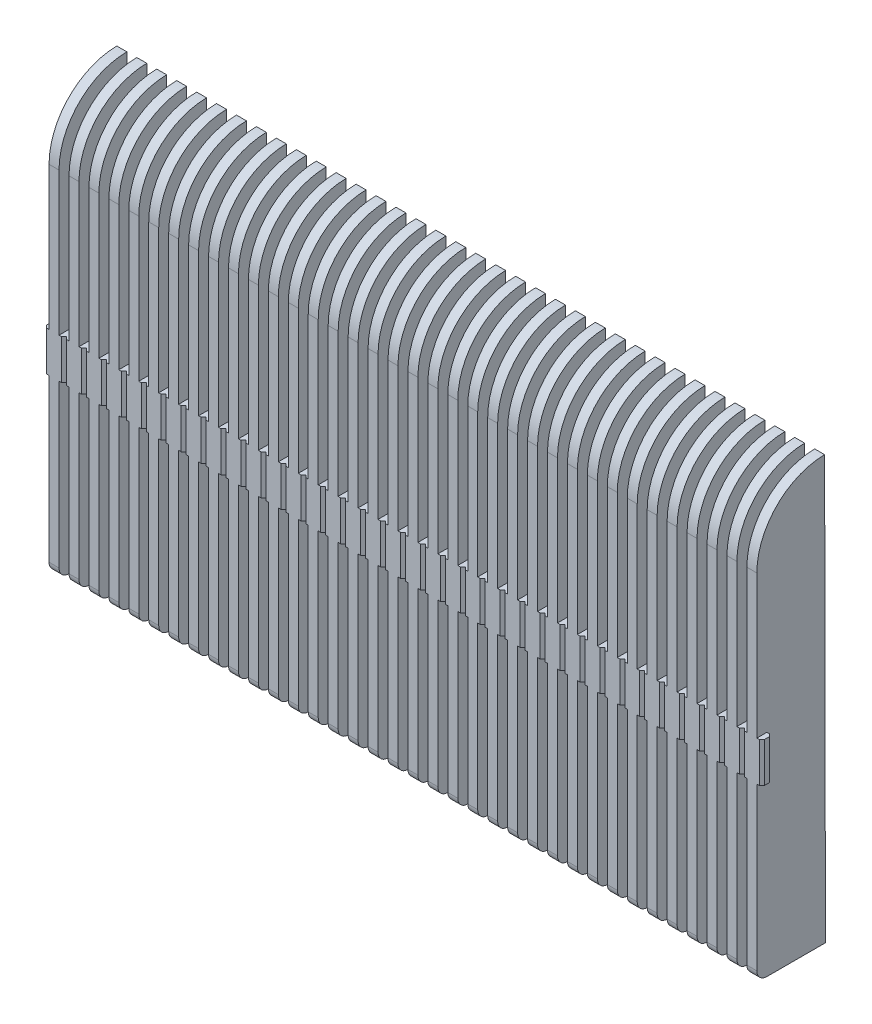
from build123d import *

# Parameters (mm, degrees)
SKETCH1_W                = 10.922
SKETCH1_H                = 12.7
SKETCH1_W_2              = 12.7
SKETCH1_H_2              = 10.922
BOSS_EXTRUDE1_DEPTH      = 2.38125
SKETCH2_W                = 12.7
SKETCH2_H                = 12.7
BOSS_EXTRUDE2_DEPTH      = 67.3862
SKETCH3_W                = 34.29
SKETCH3_H                = 34.29
BOSS_EXTRUDE3_DEPTH      = 2.38125
FILLET15_R               = 10.922
SKETCH4_R                = 5.55625
CUT_EXTRUDE1_DEPTH       = 66.675
CUT_EXTRUDE2_REACH       = 78.171
SKETCH5_W                = 10.922
SKETCH5_H                = 3.175
SKETCH5_W_2              = 3.175
SKETCH5_H_2              = 10.922
FILLET18_R               = 3.175
FILLET28_R               = 0.79375
FILLET29_R               = 1.5875
BOSS_EXTRUDE4_DEPTH      = 112.7125
CUT_EXTRUDE4_DEPTH       = 57.15
SKETCH7_W                = 1.5875
SKETCH7_H                = 67.3862
CUT_EXTRUDE5_DEPTH       = 114.3
LPATTERN1_COUNT          = 35
LPATTERN1_PITCH          = 3.175
BOSS_EXTRUDE5_DEPTH      = 0.79375
BOSS_EXTRUDE5_DEPTH_BACK = 113.50625
SKETCH8_W                = 1.5875
SKETCH8_H                = 6.35
CUT_EXTRUDE6_DEPTH       = 137.026821246
LPATTERN2_COUNT          = 36
LPATTERN2_PITCH          = 3.175
LPATTERN2_COL_COUNT      = 2
LPATTERN2_COL_PITCH      = 3.175


# Some blends are built 0.0001 mm under size
with BuildPart() as part:
    # Sketch1 → Boss-Extrude1 (new body)
    with BuildSketch(Plane(origin=(0, 0, 0), x_dir=(1, 0, 0), z_dir=(0, 1, 0))):
        with Locations((-11.811, 0)):
            Rectangle(SKETCH1_W, SKETCH1_H)
        Rectangle(SKETCH1_W_2, SKETCH1_H)
        with Locations((0, 11.811)):
            Rectangle(SKETCH1_W_2, SKETCH1_H_2)
        with Locations((11.811, 0)):
            Rectangle(SKETCH1_W, SKETCH1_H)
        with Locations((0, -11.811)):
            Rectangle(SKETCH1_W_2, SKETCH1_H_2)
    extrude(amount=BOSS_EXTRUDE1_DEPTH)

    # Sketch2 → Boss-Extrude2 (add)
    with BuildSketch(Plane(origin=(0, 2.38125, 0), x_dir=(1, 0, 0), z_dir=(0, 1, 0))):
        Rectangle(SKETCH2_W, SKETCH2_H)
    extrude(amount=BOSS_EXTRUDE2_DEPTH)

    # Sketch3 → Boss-Extrude3 (add)
    with BuildSketch(Plane(origin=(0, 69.76745, 0), x_dir=(1, 0, 0), z_dir=(0, 1, 0))):
        Rectangle(SKETCH3_W, SKETCH3_H)
    extrude(amount=BOSS_EXTRUDE3_DEPTH)

    # Fillet15
    # the kernel refuses this fillet: 10.922 mm, written as the material it adds along each edge
    with BuildSketch(Plane(origin=(6.35, 69.76745, 6.35), x_dir=(1, 0, 0), z_dir=(0, 0, -1))) as fillet15_piece_1_section:
        with BuildLine():
            CenterArc((FILLET15_R, FILLET15_R), FILLET15_R, 180, 90)
            Line((0, FILLET15_R), (0, 0))
            Line((0, 0), (FILLET15_R, 0))
        make_face()
    fillet15_piece_1 = extrude(amount=12.7, mode=Mode.PRIVATE)
    fillet15_piece_1 = split(fillet15_piece_1, bisect_by=Plane(origin=(17.145, 67.292403203, 0), z_dir=(-1, 0, 0)), keep=Keep.TOP, mode=Mode.PRIVATE)
    add(fillet15_piece_1)
    with BuildSketch(Plane(origin=(6.35, 69.76745, -6.35), x_dir=(0, 0, -1), z_dir=(-1, 0, 0))) as fillet15_piece_2_section:
        with BuildLine():
            CenterArc((FILLET15_R, FILLET15_R), FILLET15_R, 180, 90)
            Line((0, FILLET15_R), (0, 0))
            Line((0, 0), (FILLET15_R, 0))
        make_face()
    fillet15_piece_2 = extrude(amount=12.7, mode=Mode.PRIVATE)
    fillet15_piece_2 = split(fillet15_piece_2, bisect_by=Plane(origin=(0, 67.292403203, -17.145), z_dir=(0, 0, 1)), keep=Keep.TOP, mode=Mode.PRIVATE)
    add(fillet15_piece_2)
    with BuildSketch(Plane(origin=(-6.35, 69.76745, -6.35), x_dir=(-1, 0, 0), z_dir=(0, 0, 1))) as fillet15_piece_3_section:
        with BuildLine():
            CenterArc((FILLET15_R, FILLET15_R), FILLET15_R, 180, 90)
            Line((0, FILLET15_R), (0, 0))
            Line((0, 0), (FILLET15_R, 0))
        make_face()
    fillet15_piece_3 = extrude(amount=12.7, mode=Mode.PRIVATE)
    fillet15_piece_3 = split(fillet15_piece_3, bisect_by=Plane(origin=(-17.145, 67.292403203, 0), z_dir=(1, 0, 0)), keep=Keep.TOP, mode=Mode.PRIVATE)
    add(fillet15_piece_3)
    with BuildSketch(Plane(origin=(-6.35, 69.76745, 6.35), x_dir=(0, 0, 1), z_dir=(1, 0, 0))) as fillet15_piece_4_section:
        with BuildLine():
            CenterArc((FILLET15_R, FILLET15_R), FILLET15_R, 180, 90)
            Line((0, FILLET15_R), (0, 0))
            Line((0, 0), (FILLET15_R, 0))
        make_face()
    fillet15_piece_4 = extrude(amount=12.7, mode=Mode.PRIVATE)
    fillet15_piece_4 = split(fillet15_piece_4, bisect_by=Plane(origin=(0, 67.292403203, 17.145), z_dir=(0, 0, -1)), keep=Keep.TOP, mode=Mode.PRIVATE)
    add(fillet15_piece_4)
    with BuildSketch(Plane(origin=(-6.35, 69.76745, 6.35), x_dir=(0, 0, 1), z_dir=(1, 0, 0))) as fillet15_piece_5a_section:
        with BuildLine():
            CenterArc((FILLET15_R, FILLET15_R), FILLET15_R, 180, 90)
            Line((0, FILLET15_R), (0, 0))
            Line((0, 0), (FILLET15_R, 0))
        make_face()
    fillet15_piece_5a = extrude(amount=40.005, mode=Mode.PRIVATE)
    fillet15_piece_5a = split(fillet15_piece_5a, bisect_by=Plane(origin=(11.7475, 67.292403203, 17.145), z_dir=(0, 0, -1)), keep=Keep.TOP, mode=Mode.PRIVATE)
    fillet15_piece_5a = split(fillet15_piece_5a, bisect_by=Plane(origin=(17.145, 67.292403203, 8.815024112), z_dir=(-1, 0, 0)), keep=Keep.TOP, mode=Mode.PRIVATE)
    fillet15_piece_5a = split(fillet15_piece_5a, bisect_by=Plane(origin=(6.35, 67.292403203, 8.815024112), z_dir=(1, 0, 0)), keep=Keep.TOP, mode=Mode.PRIVATE)
    with BuildSketch(Plane(origin=(6.35, 69.76745, 33.655), x_dir=(1, 0, 0), z_dir=(0, 0, -1))) as fillet15_piece_5b_section:
        with BuildLine():
            CenterArc((FILLET15_R, FILLET15_R), FILLET15_R, 180, 90)
            Line((0, FILLET15_R), (0, 0))
            Line((0, 0), (FILLET15_R, 0))
        make_face()
    fillet15_piece_5b = extrude(amount=40.005, mode=Mode.PRIVATE)
    fillet15_piece_5b = split(fillet15_piece_5b, bisect_by=Plane(origin=(8.815024112, 67.292403203, 17.145), z_dir=(0, 0, -1)), keep=Keep.TOP, mode=Mode.PRIVATE)
    fillet15_piece_5b = split(fillet15_piece_5b, bisect_by=Plane(origin=(17.145, 67.292403203, 11.7475), z_dir=(-1, 0, 0)), keep=Keep.TOP, mode=Mode.PRIVATE)
    fillet15_piece_5b = split(fillet15_piece_5b, bisect_by=Plane(origin=(8.815024112, 67.292403203, 6.35), z_dir=(0, 0, 1)), keep=Keep.TOP, mode=Mode.PRIVATE)
    fillet15_piece_5 = fillet15_piece_5a & fillet15_piece_5b
    add(fillet15_piece_5)
    with BuildSketch(Plane(origin=(6.35, 69.76745, 6.35), x_dir=(1, 0, 0), z_dir=(0, 0, -1))) as fillet15_piece_6a_section:
        with BuildLine():
            CenterArc((FILLET15_R, FILLET15_R), FILLET15_R, 180, 90)
            Line((0, FILLET15_R), (0, 0))
            Line((0, 0), (FILLET15_R, 0))
        make_face()
    fillet15_piece_6a = extrude(amount=40.005, mode=Mode.PRIVATE)
    fillet15_piece_6a = split(fillet15_piece_6a, bisect_by=Plane(origin=(17.145, 67.292403203, -11.7475), z_dir=(-1, 0, 0)), keep=Keep.TOP, mode=Mode.PRIVATE)
    fillet15_piece_6a = split(fillet15_piece_6a, bisect_by=Plane(origin=(8.815024112, 67.292403203, -17.145), z_dir=(0, 0, 1)), keep=Keep.TOP, mode=Mode.PRIVATE)
    fillet15_piece_6a = split(fillet15_piece_6a, bisect_by=Plane(origin=(8.815024112, 67.292403203, -6.35), z_dir=(0, 0, -1)), keep=Keep.TOP, mode=Mode.PRIVATE)
    with BuildSketch(Plane(origin=(33.655, 69.76745, -6.35), x_dir=(0, 0, -1), z_dir=(-1, 0, 0))) as fillet15_piece_6b_section:
        with BuildLine():
            CenterArc((FILLET15_R, FILLET15_R), FILLET15_R, 180, 90)
            Line((0, FILLET15_R), (0, 0))
            Line((0, 0), (FILLET15_R, 0))
        make_face()
    fillet15_piece_6b = extrude(amount=40.005, mode=Mode.PRIVATE)
    fillet15_piece_6b = split(fillet15_piece_6b, bisect_by=Plane(origin=(17.145, 67.292403203, -8.815024112), z_dir=(-1, 0, 0)), keep=Keep.TOP, mode=Mode.PRIVATE)
    fillet15_piece_6b = split(fillet15_piece_6b, bisect_by=Plane(origin=(11.7475, 67.292403203, -17.145), z_dir=(0, 0, 1)), keep=Keep.TOP, mode=Mode.PRIVATE)
    fillet15_piece_6b = split(fillet15_piece_6b, bisect_by=Plane(origin=(6.35, 67.292403203, -8.815024112), z_dir=(1, 0, 0)), keep=Keep.TOP, mode=Mode.PRIVATE)
    fillet15_piece_6 = fillet15_piece_6a & fillet15_piece_6b
    add(fillet15_piece_6)
    with BuildSketch(Plane(origin=(-6.35, 69.76745, -33.655), x_dir=(-1, 0, 0), z_dir=(0, 0, 1))) as fillet15_piece_7a_section:
        with BuildLine():
            CenterArc((FILLET15_R, FILLET15_R), FILLET15_R, 180, 90)
            Line((0, FILLET15_R), (0, 0))
            Line((0, 0), (FILLET15_R, 0))
        make_face()
    fillet15_piece_7a = extrude(amount=40.005, mode=Mode.PRIVATE)
    fillet15_piece_7a = split(fillet15_piece_7a, bisect_by=Plane(origin=(-17.145, 67.292403203, -11.7475), z_dir=(1, 0, 0)), keep=Keep.TOP, mode=Mode.PRIVATE)
    fillet15_piece_7a = split(fillet15_piece_7a, bisect_by=Plane(origin=(-8.815024112, 67.292403203, -17.145), z_dir=(0, 0, 1)), keep=Keep.TOP, mode=Mode.PRIVATE)
    fillet15_piece_7a = split(fillet15_piece_7a, bisect_by=Plane(origin=(-8.815024112, 67.292403203, -6.35), z_dir=(0, 0, -1)), keep=Keep.TOP, mode=Mode.PRIVATE)
    with BuildSketch(Plane(origin=(6.35, 69.76745, -6.35), x_dir=(0, 0, -1), z_dir=(-1, 0, 0))) as fillet15_piece_7b_section:
        with BuildLine():
            CenterArc((FILLET15_R, FILLET15_R), FILLET15_R, 180, 90)
            Line((0, FILLET15_R), (0, 0))
            Line((0, 0), (FILLET15_R, 0))
        make_face()
    fillet15_piece_7b = extrude(amount=40.005, mode=Mode.PRIVATE)
    fillet15_piece_7b = split(fillet15_piece_7b, bisect_by=Plane(origin=(-17.145, 67.292403203, -8.815024112), z_dir=(1, 0, 0)), keep=Keep.TOP, mode=Mode.PRIVATE)
    fillet15_piece_7b = split(fillet15_piece_7b, bisect_by=Plane(origin=(-11.7475, 67.292403203, -17.145), z_dir=(0, 0, 1)), keep=Keep.TOP, mode=Mode.PRIVATE)
    fillet15_piece_7b = split(fillet15_piece_7b, bisect_by=Plane(origin=(-6.35, 67.292403203, -8.815024112), z_dir=(-1, 0, 0)), keep=Keep.TOP, mode=Mode.PRIVATE)
    fillet15_piece_7 = fillet15_piece_7a & fillet15_piece_7b
    add(fillet15_piece_7)
    with BuildSketch(Plane(origin=(-6.35, 69.76745, -6.35), x_dir=(-1, 0, 0), z_dir=(0, 0, 1))) as fillet15_piece_8a_section:
        with BuildLine():
            CenterArc((FILLET15_R, FILLET15_R), FILLET15_R, 180, 90)
            Line((0, FILLET15_R), (0, 0))
            Line((0, 0), (FILLET15_R, 0))
        make_face()
    fillet15_piece_8a = extrude(amount=40.005, mode=Mode.PRIVATE)
    fillet15_piece_8a = split(fillet15_piece_8a, bisect_by=Plane(origin=(-8.815024112, 67.292403203, 17.145), z_dir=(0, 0, -1)), keep=Keep.TOP, mode=Mode.PRIVATE)
    fillet15_piece_8a = split(fillet15_piece_8a, bisect_by=Plane(origin=(-17.145, 67.292403203, 11.7475), z_dir=(1, 0, 0)), keep=Keep.TOP, mode=Mode.PRIVATE)
    fillet15_piece_8a = split(fillet15_piece_8a, bisect_by=Plane(origin=(-8.815024112, 67.292403203, 6.35), z_dir=(0, 0, 1)), keep=Keep.TOP, mode=Mode.PRIVATE)
    with BuildSketch(Plane(origin=(-33.655, 69.76745, 6.35), x_dir=(0, 0, 1), z_dir=(1, 0, 0))) as fillet15_piece_8b_section:
        with BuildLine():
            CenterArc((FILLET15_R, FILLET15_R), FILLET15_R, 180, 90)
            Line((0, FILLET15_R), (0, 0))
            Line((0, 0), (FILLET15_R, 0))
        make_face()
    fillet15_piece_8b = extrude(amount=40.005, mode=Mode.PRIVATE)
    fillet15_piece_8b = split(fillet15_piece_8b, bisect_by=Plane(origin=(-11.7475, 67.292403203, 17.145), z_dir=(0, 0, -1)), keep=Keep.TOP, mode=Mode.PRIVATE)
    fillet15_piece_8b = split(fillet15_piece_8b, bisect_by=Plane(origin=(-17.145, 67.292403203, 8.815024112), z_dir=(1, 0, 0)), keep=Keep.TOP, mode=Mode.PRIVATE)
    fillet15_piece_8b = split(fillet15_piece_8b, bisect_by=Plane(origin=(-6.35, 67.292403203, 8.815024112), z_dir=(-1, 0, 0)), keep=Keep.TOP, mode=Mode.PRIVATE)
    fillet15_piece_8 = fillet15_piece_8a & fillet15_piece_8b
    add(fillet15_piece_8)

    # Sketch4 → Cut-Extrude1 (cut)
    with BuildSketch(Plane.XZ):
        with Locations(Location((0, 0, 0), (0, 0, 270))):
            Circle(SKETCH4_R)
    extrude(amount=-CUT_EXTRUDE1_DEPTH, mode=Mode.SUBTRACT)

    # Sketch5 → Cut-Extrude2 (cut, up to next)
    with BuildSketch(Plane.XZ, mode=Mode.PRIVATE) as cut_extrude2_sk1:
        with Locations((-11.811, 4.7625)):
            Rectangle(SKETCH5_W, SKETCH5_H)
    cut_extrude2_tool1 = extrude(cut_extrude2_sk1.sketch, amount=-CUT_EXTRUDE2_REACH, mode=Mode.PRIVATE) & part.part
    # Sketch5 → Cut-Extrude2 (cut, up to next)
    with BuildSketch(Plane.XZ, mode=Mode.PRIVATE) as cut_extrude2_sk2:
        with Locations((-4.7625, 11.811)):
            Rectangle(SKETCH5_W_2, SKETCH5_H_2)
    cut_extrude2_tool2 = extrude(cut_extrude2_sk2.sketch, amount=-CUT_EXTRUDE2_REACH, mode=Mode.PRIVATE) & part.part
    # Sketch5 → Cut-Extrude2 (cut, up to next)
    with BuildSketch(Plane.XZ, mode=Mode.PRIVATE) as cut_extrude2_sk3:
        with Locations((4.7625, 11.811)):
            Rectangle(SKETCH5_W_2, SKETCH5_H_2)
    cut_extrude2_tool3 = extrude(cut_extrude2_sk3.sketch, amount=-CUT_EXTRUDE2_REACH, mode=Mode.PRIVATE) & part.part
    # Sketch5 → Cut-Extrude2 (cut, up to next)
    with BuildSketch(Plane.XZ, mode=Mode.PRIVATE) as cut_extrude2_sk4:
        with Locations((11.811, 4.7625)):
            Rectangle(SKETCH5_W, SKETCH5_H)
    cut_extrude2_tool4 = extrude(cut_extrude2_sk4.sketch, amount=-CUT_EXTRUDE2_REACH, mode=Mode.PRIVATE) & part.part
    # Sketch5 → Cut-Extrude2 (cut, up to next)
    with BuildSketch(Plane.XZ, mode=Mode.PRIVATE) as cut_extrude2_sk5:
        with Locations((11.811, -4.7625)):
            Rectangle(SKETCH5_W, SKETCH5_H)
    cut_extrude2_tool5 = extrude(cut_extrude2_sk5.sketch, amount=-CUT_EXTRUDE2_REACH, mode=Mode.PRIVATE) & part.part
    # Sketch5 → Cut-Extrude2 (cut, up to next)
    with BuildSketch(Plane.XZ, mode=Mode.PRIVATE) as cut_extrude2_sk6:
        with Locations((4.7625, -11.811)):
            Rectangle(SKETCH5_W_2, SKETCH5_H_2)
    cut_extrude2_tool6 = extrude(cut_extrude2_sk6.sketch, amount=-CUT_EXTRUDE2_REACH, mode=Mode.PRIVATE) & part.part
    # Sketch5 → Cut-Extrude2 (cut, up to next)
    with BuildSketch(Plane.XZ, mode=Mode.PRIVATE) as cut_extrude2_sk7:
        with Locations((-4.7625, -11.811)):
            Rectangle(SKETCH5_W_2, SKETCH5_H_2)
    cut_extrude2_tool7 = extrude(cut_extrude2_sk7.sketch, amount=-CUT_EXTRUDE2_REACH, mode=Mode.PRIVATE) & part.part
    # Sketch5 → Cut-Extrude2 (cut, up to next)
    with BuildSketch(Plane.XZ, mode=Mode.PRIVATE) as cut_extrude2_sk8:
        with Locations((-11.811, -4.7625)):
            Rectangle(SKETCH5_W, SKETCH5_H)
    cut_extrude2_tool8 = extrude(cut_extrude2_sk8.sketch, amount=-CUT_EXTRUDE2_REACH, mode=Mode.PRIVATE) & part.part
    add(cut_extrude2_tool1.solids().sort_by_distance((-11.811, 0, 4.7625))[0], mode=Mode.SUBTRACT)
    add(cut_extrude2_tool2.solids().sort_by_distance((-4.7625, 0, 11.811))[0], mode=Mode.SUBTRACT)
    add(cut_extrude2_tool3.solids().sort_by_distance((4.7625, 0, 11.811))[0], mode=Mode.SUBTRACT)
    add(cut_extrude2_tool4.solids().sort_by_distance((11.811, 0, 4.7625))[0], mode=Mode.SUBTRACT)
    add(cut_extrude2_tool5.solids().sort_by_distance((11.811, 0, -4.7625))[0], mode=Mode.SUBTRACT)
    add(cut_extrude2_tool6.solids().sort_by_distance((4.7625, 0, -11.811))[0], mode=Mode.SUBTRACT)
    add(cut_extrude2_tool7.solids().sort_by_distance((-4.7625, 0, -11.811))[0], mode=Mode.SUBTRACT)
    add(cut_extrude2_tool8.solids().sort_by_distance((-11.811, 0, -4.7625))[0], mode=Mode.SUBTRACT)

    # Fillet18
    fillet18_edges = [part.edges().sort_by_distance(p)[0] for p in [
        (-17.272, 1.190625, 3.175),
        (-17.272, 1.190625, -3.175),
        (-3.175, 1.190625, -17.272),
        (3.175, 1.190625, -17.272),
        (17.272, 1.190625, -3.175),
        (17.272, 1.190625, 3.175),
        (-3.175, 1.190625, 17.272),
        (3.175, 1.190625, 17.272),
    ]]
    fillet(fillet18_edges, radius=FILLET18_R - 0.0001)  # a hair under: the kernel refuses the full size

    # Fillet28
    fillet28_edges = [part.edges().sort_by_distance(p)[0] for p in [
        (-3.175, 1.190625, 6.35),
        (3.175, 1.190625, 6.35),
        (6.35, 1.190625, 3.175),
        (6.35, 1.190625, -3.175),
        (3.175, 1.190625, -6.35),
        (-3.175, 1.190625, -6.35),
        (-6.35, 1.190625, -3.175),
        (-6.35, 1.190625, 3.175),
    ]]
    fillet(fillet28_edges, radius=FILLET28_R)

    # Fillet29
    fillet29_edges = [part.edges().sort_by_distance(p)[0] for p in [
        (-6.35, 2.38125, 0),
        (0, 2.38125, -6.35),
        (0, 2.38125, 6.35),
        (6.35, 2.38125, 0),
    ]]
    fillet(fillet29_edges, radius=FILLET29_R)

    # Sketch6<5> → Cut-Extrude4 (cut, symmetric)
    with BuildSketch(Plane(origin=(17.145, 0, 0), x_dir=(0, 0, -1), z_dir=(1, 0, 0))):
        with BuildLine():
            ThreePointArc((17.145, 69.76745), (9.504208229, 66.524176089), (6.35, 58.846188397))
            Line((6.35, 58.846188397), (6.35, 3.96875))
            ThreePointArc((6.35, 3.96875), (6.814967985, 2.846217985), (7.9375, 2.38125))
            Line((7.9375, 2.38125), (17.272, 2.38125))
            Line((17.272, 2.38125), (17.145, 69.76745))
        make_face()
        with BuildLine():
            Line((6.35, 3.96875), (6.35, 58.846188397))
            ThreePointArc((6.35, 58.846188397), (9.504208229, 66.524176089), (17.145, 69.76745))
            Line((17.145, 69.76745), (17.145, 72.1487))
            Line((17.145, 72.1487), (-17.145, 72.1487))
            Line((-17.145, 72.1487), (-17.145, 3.019950154))
            Line((-17.145, 3.019950154), (-18.438675534, 3.019950154))
            Line((-18.438675534, 3.019950154), (-18.438675534, -0.492043114))
            Line((-18.438675534, -0.492043114), (20.241557353, -0.492043114))
            Line((20.241557353, -0.492043114), (20.241557353, 2.38125))
            Line((20.241557353, 2.38125), (17.272, 2.38125))
            Line((17.272, 2.38125), (7.9375, 2.38125))
            ThreePointArc((7.9375, 2.38125), (6.814967985, 2.846217985), (6.35, 3.96875))
        make_face()
    extrude(amount=CUT_EXTRUDE4_DEPTH, both=True, mode=Mode.SUBTRACT)


with BuildPart() as body_2:
    # Sketch6 → Boss-Extrude4 (new body)
    with BuildSketch(Plane(origin=(17.145, 0, 0), x_dir=(0, 0, -1), z_dir=(1, 0, 0))):
        with BuildLine():
            ThreePointArc((7.9375, 2.38125), (6.814967985, 2.846217985), (6.35, 3.96875))
            Line((6.35, 3.96875), (6.35, 58.846188397))
            ThreePointArc((6.35, 58.846188397), (9.504208229, 66.524176089), (17.145, 69.76745))
            Line((17.145, 69.76745), (17.272, 2.38125))
            Line((17.272, 2.38125), (7.9375, 2.38125))
        make_face()
    extrude(amount=BOSS_EXTRUDE4_DEPTH)

    # Sketch7 → Cut-Extrude5 (cut)
    with BuildSketch(Plane.XY.offset(-6.35)):
        with Locations((127.47625, 36.07435)):
            Rectangle(SKETCH7_W, SKETCH7_H)
    cut_extrude5 = extrude(amount=-CUT_EXTRUDE5_DEPTH, mode=Mode.SUBTRACT)


with BuildPart() as cut_extrude5_piece_1:
    # of the separate pieces the step leaves, piece 1, a body of its own (cut_extrude5_pieces)
    add(body_2.part.solids().sort_by_distance((17.145, 2.38125, -7.9375))[0])

    # LPattern1: Cut-Extrude5 ×35
    with Locations(*[(-i * LPATTERN1_PITCH, 0, 0) for i in range(1, LPATTERN1_COUNT)]):
        add(cut_extrude5, mode=Mode.SUBTRACT)



with BuildPart() as cut_extrude5_piece_2:
    # of the separate pieces the step leaves, piece 2, a body of its own (cut_extrude5_pieces)
    add(body_2.part.solids().sort_by_distance((128.27, 2.38125, -7.9375))[0])


with BuildPart() as cut_extrude5_piece_1_1:
    add(cut_extrude5_piece_1.part)

    add(cut_extrude5_piece_2.part)  # Boss-Extrude5 merges Cut-Extrude5 piece 2
    # Sketch8 → Boss-Extrude5 (add, two sides: drawn at the far end of the back side and taken through both)
    with BuildSketch(Plane(origin=(129.8575, 0, 0), x_dir=(0, 0, -1), z_dir=(1, 0, 0)).offset(-BOSS_EXTRUDE5_DEPTH_BACK)):
        with Locations((7.14375, 32.89935)):
            Rectangle(SKETCH8_W, SKETCH8_H)
    extrude(amount=BOSS_EXTRUDE5_DEPTH + BOSS_EXTRUDE5_DEPTH_BACK)

    # Sketch9 → Cut-Extrude6 (cut, through all)
    with BuildSketch(Plane(origin=(0, 36.07435, 0), x_dir=(1, 0, 0), z_dir=(0, 1, 0))):
        Polygon((127.079375, 7.9375), (127.47625, 7.540625), (127.873125, 7.9375), align=None)
        Polygon((127.873125, 6.35), (127.079375, 6.35), (127.47625, 6.746875), align=None)
    cut_extrude6 = extrude(amount=-CUT_EXTRUDE6_DEPTH, mode=Mode.SUBTRACT)

    # LPattern2: Cut-Extrude6 ×36
    with Locations(*[(-i * LPATTERN2_PITCH, 0, 0) for i in range(1, LPATTERN2_COUNT)]):
        add(cut_extrude6, mode=Mode.SUBTRACT)

    # LPattern2 col: Cut-Extrude6 ×2
    with Locations(*[(i * LPATTERN2_COL_PITCH, 0, 0) for i in range(1, LPATTERN2_COL_COUNT)]):
        add(cut_extrude6, mode=Mode.SUBTRACT)


solid = cut_extrude5_piece_1_1.part
